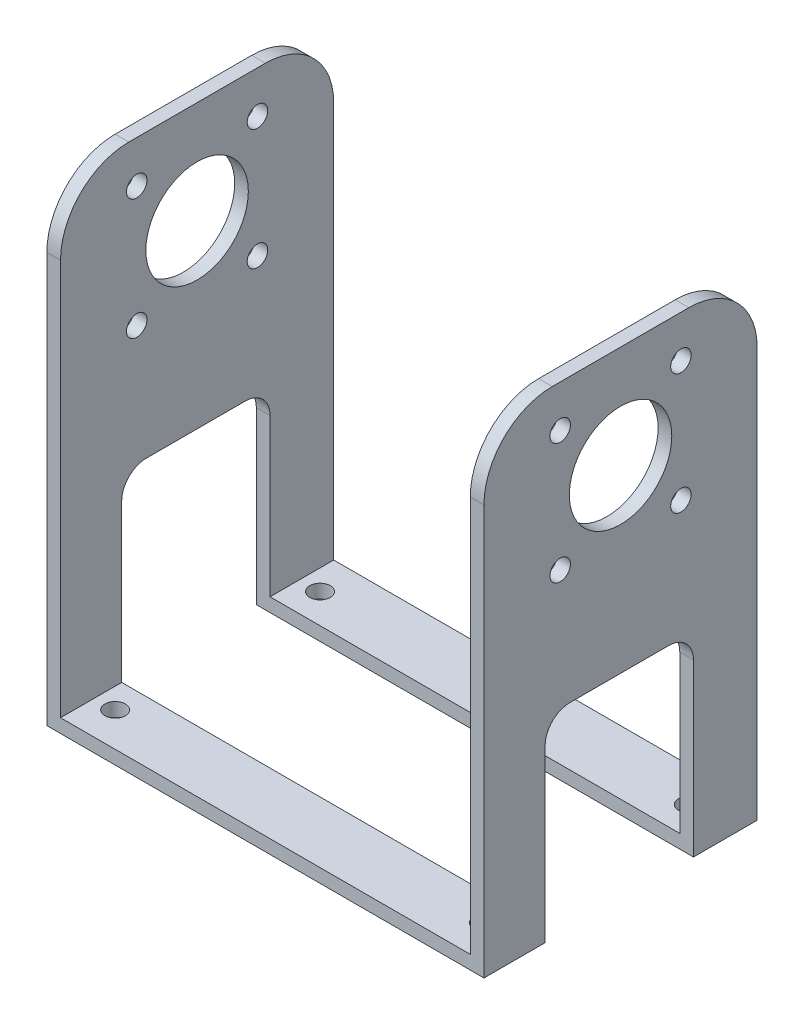
from build123d import *

# Parameters (mm, degrees)
EXTRUDE_THIN1_DEPTH = 40
SKETCH2_R           = 7.5
CUT_EXTRUDE2_DEPTH  = 60
FILLET1_R           = 10
SKETCH3_R           = 1.5
CUT_EXTRUDE4_DEPTH  = 20
SKETCH4_R           = 1.5
CUT_EXTRUDE5_DEPTH  = 140


with BuildPart() as part:
    # Sketch1 → Extrude-Thin1 (new body)
    with BuildSketch(Plane.XY):
        Polygon((-32, 0), (0, 0), (0, 70), (-2, 70), (-2, 2), (-32, 2), align=None)
    extrude(amount=EXTRUDE_THIN1_DEPTH)

    # Sketch2 → Cut-Extrude2 (cut)
    with BuildSketch(Plane(origin=(0, 0, 0), x_dir=(0, 0, -1), z_dir=(1, 0, 0))):
        with Locations((-20, 55)):
            Circle(SKETCH2_R)
        with BuildLine():
            Line((-31.039452712, 25), (-31.039452712, 0))
            Line((-31.039452712, 0), (-9.327670915, 0))
            Line((-9.327670915, 0), (-9.327670915, 25))
            ThreePointArc((-9.327670915, 25), (-10.390515474, 27.56593375), (-12.956449225, 28.62877831))
            Line((-12.956449225, 28.62877831), (-27.410674402, 28.62877831))
            ThreePointArc((-27.410674402, 28.62877831), (-29.976608153, 27.56593375), (-31.039452712, 25))
        make_face()
    extrude(amount=-CUT_EXTRUDE2_DEPTH, mode=Mode.SUBTRACT)

    # Fillet1
    fillet1_edges = [part.edges().sort_by_distance(p)[0] for p in [
        (-1, 70, 0),
        (-1, 70, 40),
    ]]
    fillet(fillet1_edges, radius=FILLET1_R)

    # Mirror1: part across plane


with BuildPart() as part_1:
    add(part.part)
    add(part.part.mirror(Plane(origin=(-32, 0, 40), x_dir=(0, 0, 1), z_dir=(-1, 0, 0))))

    # Sketch3 → Cut-Extrude4 (cut)
    with BuildSketch(Plane.XZ):
        with Locations((-59, 35)):
            Circle(SKETCH3_R)
        with Locations((-5, 35)):
            Circle(SKETCH3_R)
        with Locations((-5, 5)):
            Circle(SKETCH3_R)
        with Locations((-59, 5)):
            Circle(SKETCH3_R)
    extrude(amount=-CUT_EXTRUDE4_DEPTH, mode=Mode.SUBTRACT)

    # Sketch4 → Cut-Extrude5 (cut)
    with BuildSketch(Plane(origin=(0, 0, 0), x_dir=(0, 0, -1), z_dir=(1, 0, 0))):
        with Locations((-28.838834765, 63.838834765)):
            Circle(SKETCH4_R)
        with Locations((-11.161165235, 63.838834765)):
            Circle(SKETCH4_R)
        with Locations((-11.161165235, 46.161165235)):
            Circle(SKETCH4_R)
        with Locations((-28.838834765, 46.161165235)):
            Circle(SKETCH4_R)
    extrude(amount=-CUT_EXTRUDE5_DEPTH, mode=Mode.SUBTRACT)


solid = part_1.part
